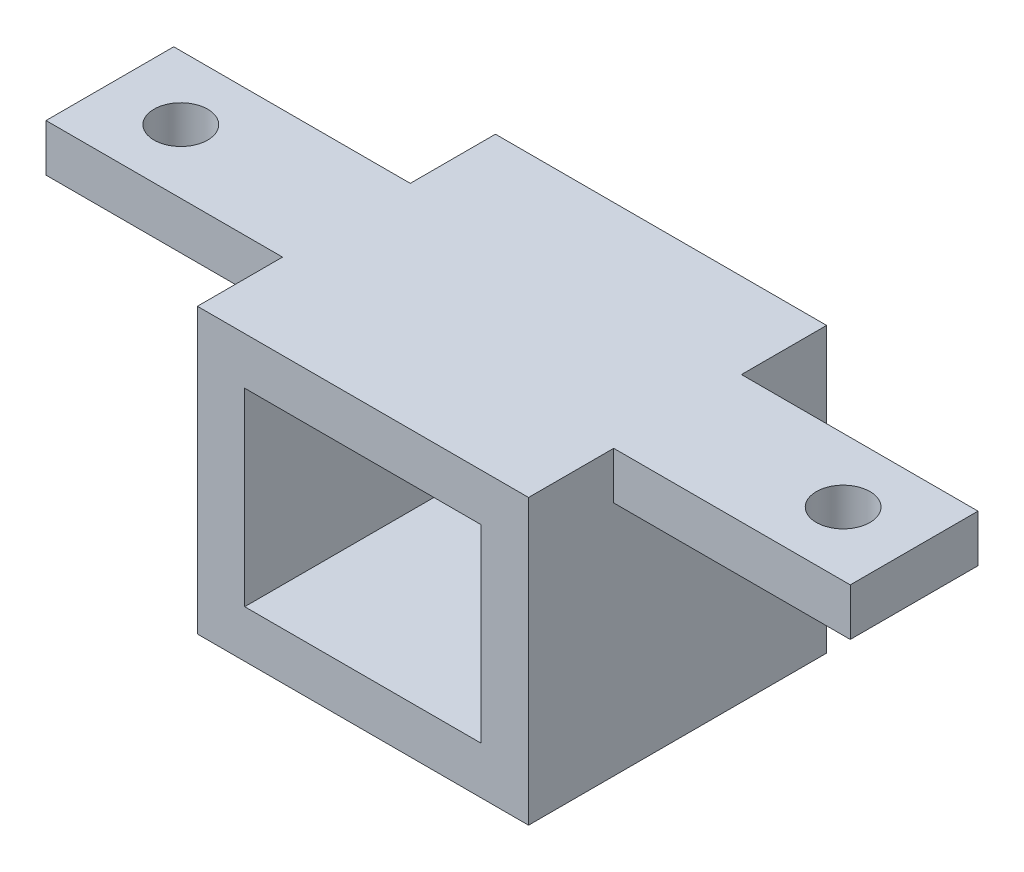
from build123d import *

# Parameters (mm, degrees)
BOSS_EXTRUDE1_DEPTH = 2.54
SKETCH2_R           = 1.44
CUT_EXTRUDE1_DEPTH  = 24.164535415
BOSS_EXTRUDE2_DEPTH = 10.16
SKETCH4_W           = 17.78
SKETCH4_H           = 16.002
BOSS_EXTRUDE3_DEPTH = 2.54
SKETCH5_R           = 1.778
SKETCH5_R_2         = 0.508
CUT_EXTRUDE2_DEPTH  = 30.723426855


with BuildPart() as part:
    # Sketch1 → Boss-Extrude1 (new body)
    with BuildSketch(Plane(origin=(0, 0, 0), x_dir=(1, 0, 0), z_dir=(0, 1, 0))):
        Polygon((-8.89, -8.001), (8.89, -8.001), (8.89, -3.429), (21.59, -3.429), (21.59, 3.429), (8.89, 3.429), (8.89, 8.001), (-8.89, 8.001), (-8.89, 3.429), (-21.59, 3.429), (-21.59, -3.429), (-8.89, -3.429), align=None)
    extrude(amount=BOSS_EXTRUDE1_DEPTH)

    # Sketch2 → Cut-Extrude1 (cut, through all)
    with BuildSketch(Plane.XZ):
        with Locations((-17.78, 0)):
            Circle(SKETCH2_R)
        with Locations((17.78, 0)):
            Circle(SKETCH2_R)
    extrude(amount=-CUT_EXTRUDE1_DEPTH, mode=Mode.SUBTRACT)

    # Sketch3 → Boss-Extrude2 (add)
    with BuildSketch(Plane(origin=(0, 0, 0), x_dir=(-1, 0, 0), z_dir=(0, -1, 0))):
        Polygon((6.35, -8.001), (8.89, -8.001), (8.89, 8.001), (-8.89, 8.001), (-8.89, -8.001), (-6.35, -8.001), (-6.35, 5.461), (6.35, 5.461), align=None)
    extrude(amount=BOSS_EXTRUDE2_DEPTH)

    # Sketch4 → Boss-Extrude3 (add)
    with BuildSketch(Plane(origin=(0, -10.16, 0), x_dir=(-1, 0, 0), z_dir=(0, -1, 0))):
        Rectangle(SKETCH4_W, SKETCH4_H)
    extrude(amount=BOSS_EXTRUDE3_DEPTH)

    # Sketch5 → Cut-Extrude2 (cut, through all)
    with BuildSketch(Plane(origin=(0, 0, -8.001), x_dir=(-1, 0, 0), z_dir=(0, 0, -1))):
        with Locations((0, -5.08)):
            Circle(SKETCH5_R)
        with Locations((5.334, -5.08)):
            Circle(SKETCH5_R_2)
        with Locations((-5.334, -5.08)):
            Circle(SKETCH5_R_2)
    extrude(amount=-CUT_EXTRUDE2_DEPTH, mode=Mode.SUBTRACT)


solid = part.part
